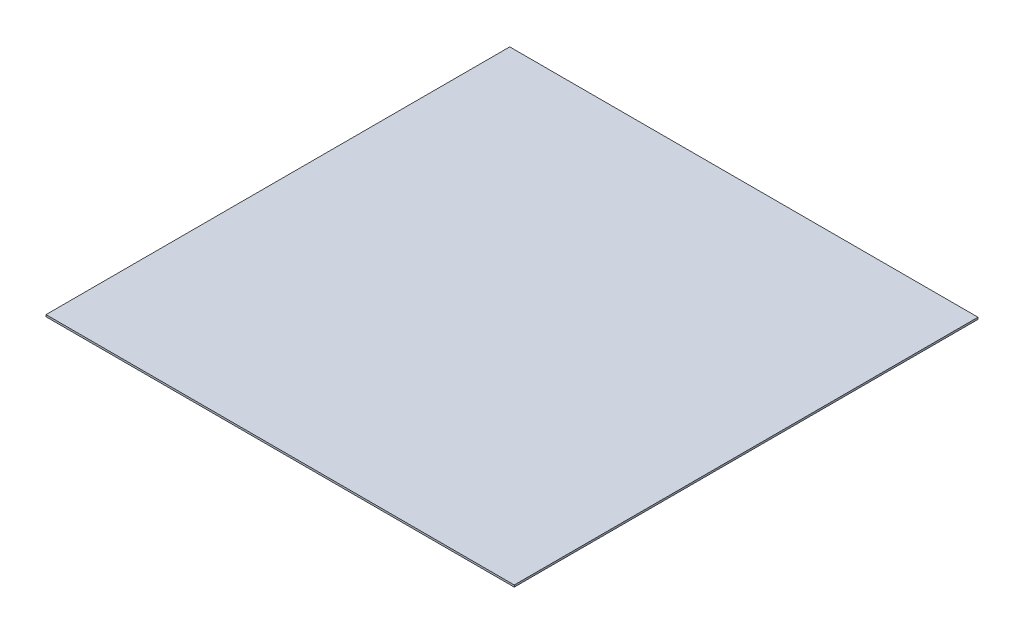
from build123d import *

# Parameters (mm, degrees)
SKETCH1_W          = 393.79984
SKETCH1_H          = 390
BASE_FLANGE1_DEPTH = 1.5875


# Sheet-metal steps are written as plain solids
with BuildPart() as part:
    # Sketch1 → Base-Flange1 (new body)
    with BuildSketch(Plane(origin=(0, 0, 0), x_dir=(1, 0, 0), z_dir=(0, 1, 0))):
        Rectangle(SKETCH1_W, SKETCH1_H)
    extrude(amount=-BASE_FLANGE1_DEPTH)


solid = part.part
